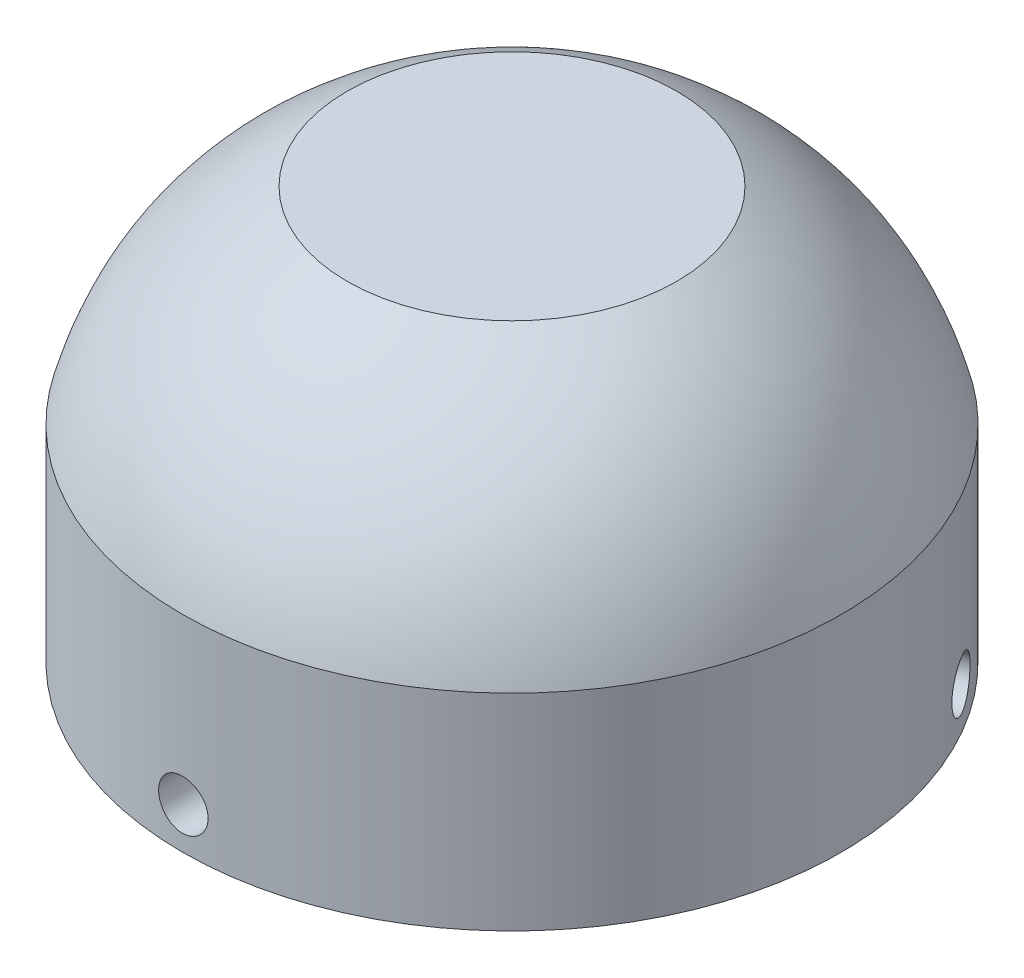
from build123d import *

# Parameters (mm, degrees)
CUT_EXTRUDE1_REACH = 96.34
SKETCH2_R          = 3
CIRPATTERN1_COUNT  = 3


with BuildPart() as part:
    # Sketch1 → Revolve1 (revolve)
    with BuildSketch(Plane.XY):
        with BuildLine():
            Line((-20, 30), (0, 30))
            Line((0, 30), (0, 22.928932188))
            Line((0, 22.928932188), (-20, 22.928932188))
            add(Edge.make_bspline(
                [(-20, 22.928932188), (-32.99251078, 14.579736434), (-35, 0)],
                knots=[0, 0, 0, 1, 1, 1], degree=2))
            Line((-35, 0), (-35, -20))
            Line((-35, -20), (-40, -20))
            Line((-40, -20), (-40, 0))
            Line((-40, 0), (-40, 5))
            add(Edge.make_bspline(
                [(-20, 30), (-35.448934618, 21.981430701), (-40, 5)],
                knots=[0, 0, 0, 1, 1, 1], degree=2))
        make_face()
    revolve(axis=Axis((0, -63.953488372, 0), (0, 1, 0)))

    # Sketch2 → Cut-Extrude1 (cut, up to next)
    with BuildSketch(Plane.XY.offset(40), mode=Mode.PRIVATE) as cut_extrude1_sk1:
        with Locations((0, -15)):
            Circle(SKETCH2_R)
    cut_extrude1_tool1 = extrude(cut_extrude1_sk1.sketch, amount=-CUT_EXTRUDE1_REACH, mode=Mode.PRIVATE) & part.part
    cut_extrude1 = cut_extrude1_tool1.solids().sort_by_distance((0, -15, 40))[0]
    add(cut_extrude1, mode=Mode.SUBTRACT)

    # CirPattern1: Cut-Extrude1 ×3 about axis
    cirpattern1_axis = Axis((0, 5, 0), (0, -1, 0))
    for i in range(1, CIRPATTERN1_COUNT):
        add(cut_extrude1.rotate(cirpattern1_axis, i * 360 / CIRPATTERN1_COUNT), mode=Mode.SUBTRACT)


solid = part.part
